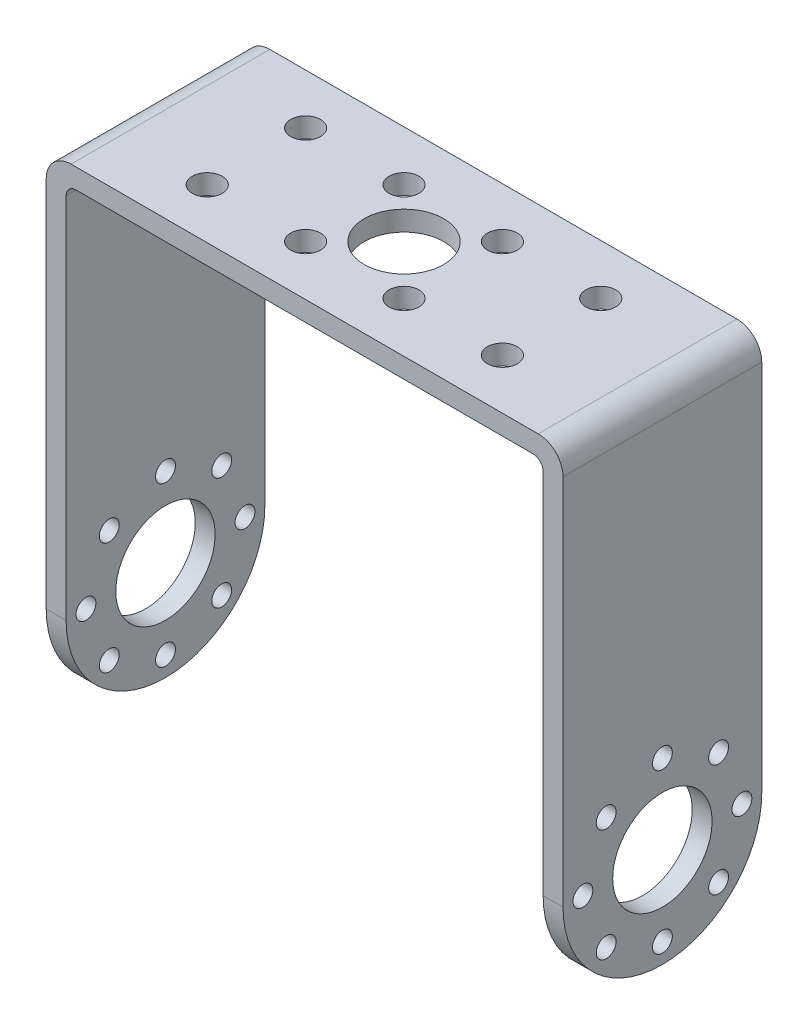
from build123d import *

# Parameters (mm, degrees)
EXTRUDE_1_DEPTH     = 20
FILLET_1_R          = 10
CUT_EXTRUDE_1_REACH = 61.8
SKETCH_3_R          = 4
SKETCH_3_R_2        = 1.5
SKETCH_4_R          = 5
SKETCH_4_R_2        = 1
CUT_EXTRUDE_2_DEPTH = 62.065538563
FILLET_2_R          = 2.5
FILLET_3_R          = 1


with BuildPart() as part:
    # 草图1 → 凸台-拉伸1 (new body)
    with BuildSketch(Plane.XY):
        Polygon((-24, 23), (24, 23), (24, -25), (26, -25), (26, 25), (-26, 25), (-26, -25), (-24, -25), align=None)
    extrude(amount=EXTRUDE_1_DEPTH)

    # 圆角1
    fillet_1_edges = [part.edges().sort_by_distance(p)[0] for p in [
        (-25, -25, 20),
        (-25, -25, 0),
        (25, -25, 0),
        (25, -25, 20),
    ]]
    fillet(fillet_1_edges, radius=FILLET_1_R - 0.0001)  # a hair under: the kernel refuses the full size

    # 草图3 → 切除-拉伸1 (cut, up to next)
    with BuildSketch(Plane(origin=(0, 25, 0), x_dir=(1, 0, 0), z_dir=(0, 1, 0)), mode=Mode.PRIVATE) as cut_extrude_1_sk1:
        with Locations(Location((0, -10, 0), (0, 0, 270))):
            Circle(SKETCH_3_R)
    cut_extrude_1_tool1 = extrude(cut_extrude_1_sk1.sketch, amount=-CUT_EXTRUDE_1_REACH, mode=Mode.PRIVATE) & part.part
    # 草图3 → 切除-拉伸1 (cut, up to next)
    with BuildSketch(Plane(origin=(0, 25, 0), x_dir=(1, 0, 0), z_dir=(0, 1, 0)), mode=Mode.PRIVATE) as cut_extrude_1_sk2:
        with Locations(Location((-4.949747468, -14.949747468, 0), (0, 0, 270))):
            Circle(SKETCH_3_R_2)
    cut_extrude_1_tool2 = extrude(cut_extrude_1_sk2.sketch, amount=-CUT_EXTRUDE_1_REACH, mode=Mode.PRIVATE) & part.part
    # 草图3 → 切除-拉伸1 (cut, up to next)
    with BuildSketch(Plane(origin=(0, 25, 0), x_dir=(1, 0, 0), z_dir=(0, 1, 0)), mode=Mode.PRIVATE) as cut_extrude_1_sk3:
        with Locations(Location((-4.949747468, -5.050252532, 0), (0, 0, 270))):
            Circle(SKETCH_3_R_2)
    cut_extrude_1_tool3 = extrude(cut_extrude_1_sk3.sketch, amount=-CUT_EXTRUDE_1_REACH, mode=Mode.PRIVATE) & part.part
    # 草图3 → 切除-拉伸1 (cut, up to next)
    with BuildSketch(Plane(origin=(0, 25, 0), x_dir=(1, 0, 0), z_dir=(0, 1, 0)), mode=Mode.PRIVATE) as cut_extrude_1_sk4:
        with Locations(Location((4.949747468, -5.050252532, 0), (0, 0, 270))):
            Circle(SKETCH_3_R_2)
    cut_extrude_1_tool4 = extrude(cut_extrude_1_sk4.sketch, amount=-CUT_EXTRUDE_1_REACH, mode=Mode.PRIVATE) & part.part
    # 草图3 → 切除-拉伸1 (cut, up to next)
    with BuildSketch(Plane(origin=(0, 25, 0), x_dir=(1, 0, 0), z_dir=(0, 1, 0)), mode=Mode.PRIVATE) as cut_extrude_1_sk5:
        with Locations(Location((4.949747468, -14.949747468, 0), (0, 0, 270))):
            Circle(SKETCH_3_R_2)
    cut_extrude_1_tool5 = extrude(cut_extrude_1_sk5.sketch, amount=-CUT_EXTRUDE_1_REACH, mode=Mode.PRIVATE) & part.part
    # 草图3 → 切除-拉伸1 (cut, up to next)
    with BuildSketch(Plane(origin=(0, 25, 0), x_dir=(1, 0, 0), z_dir=(0, 1, 0)), mode=Mode.PRIVATE) as cut_extrude_1_sk6:
        with Locations(Location((-14.849242405, -14.949747468, 0), (0, 0, 270))):
            Circle(SKETCH_3_R_2)
    cut_extrude_1_tool6 = extrude(cut_extrude_1_sk6.sketch, amount=-CUT_EXTRUDE_1_REACH, mode=Mode.PRIVATE) & part.part
    # 草图3 → 切除-拉伸1 (cut, up to next)
    with BuildSketch(Plane(origin=(0, 25, 0), x_dir=(1, 0, 0), z_dir=(0, 1, 0)), mode=Mode.PRIVATE) as cut_extrude_1_sk7:
        with Locations(Location((-14.849242405, -5.050252532, 0), (0, 0, 270))):
            Circle(SKETCH_3_R_2)
    cut_extrude_1_tool7 = extrude(cut_extrude_1_sk7.sketch, amount=-CUT_EXTRUDE_1_REACH, mode=Mode.PRIVATE) & part.part
    # 草图3 → 切除-拉伸1 (cut, up to next)
    with BuildSketch(Plane(origin=(0, 25, 0), x_dir=(1, 0, 0), z_dir=(0, 1, 0)), mode=Mode.PRIVATE) as cut_extrude_1_sk8:
        with Locations(Location((14.849242405, -5.050252532, 0), (0, 0, 270))):
            Circle(SKETCH_3_R_2)
    cut_extrude_1_tool8 = extrude(cut_extrude_1_sk8.sketch, amount=-CUT_EXTRUDE_1_REACH, mode=Mode.PRIVATE) & part.part
    # 草图3 → 切除-拉伸1 (cut, up to next)
    with BuildSketch(Plane(origin=(0, 25, 0), x_dir=(1, 0, 0), z_dir=(0, 1, 0)), mode=Mode.PRIVATE) as cut_extrude_1_sk9:
        with Locations(Location((14.849242405, -14.949747468, 0), (0, 0, 270))):
            Circle(SKETCH_3_R_2)
    cut_extrude_1_tool9 = extrude(cut_extrude_1_sk9.sketch, amount=-CUT_EXTRUDE_1_REACH, mode=Mode.PRIVATE) & part.part
    add(cut_extrude_1_tool1.solids().sort_by_distance((0, 25, 10))[0], mode=Mode.SUBTRACT)
    add(cut_extrude_1_tool2.solids().sort_by_distance((-4.949747, 25, 14.949747))[0], mode=Mode.SUBTRACT)
    add(cut_extrude_1_tool3.solids().sort_by_distance((-4.949747, 25, 5.050253))[0], mode=Mode.SUBTRACT)
    add(cut_extrude_1_tool4.solids().sort_by_distance((4.949747, 25, 5.050253))[0], mode=Mode.SUBTRACT)
    add(cut_extrude_1_tool5.solids().sort_by_distance((4.949747, 25, 14.949747))[0], mode=Mode.SUBTRACT)
    add(cut_extrude_1_tool6.solids().sort_by_distance((-14.849242, 25, 14.949747))[0], mode=Mode.SUBTRACT)
    add(cut_extrude_1_tool7.solids().sort_by_distance((-14.849242, 25, 5.050253))[0], mode=Mode.SUBTRACT)
    add(cut_extrude_1_tool8.solids().sort_by_distance((14.849242, 25, 5.050253))[0], mode=Mode.SUBTRACT)
    add(cut_extrude_1_tool9.solids().sort_by_distance((14.849242, 25, 14.949747))[0], mode=Mode.SUBTRACT)

    # 草图4 → 切除-拉伸2 (cut, through all)
    with BuildSketch(Plane.ZY.offset(26)):
        with Locations((10, -15)):
            Circle(SKETCH_4_R)
        with Locations((10, -7)):
            Circle(SKETCH_4_R_2)
        with Locations((15.656854249, -9.343145751)):
            Circle(SKETCH_4_R_2)
        with Locations((18, -15)):
            Circle(SKETCH_4_R_2)
        with Locations((15.656854249, -20.656854249)):
            Circle(SKETCH_4_R_2)
        with Locations((10, -23)):
            Circle(SKETCH_4_R_2)
        with Locations((4.343145751, -20.656854249)):
            Circle(SKETCH_4_R_2)
        with Locations((2, -15)):
            Circle(SKETCH_4_R_2)
        with Locations((4.343145751, -9.343145751)):
            Circle(SKETCH_4_R_2)
    extrude(amount=-CUT_EXTRUDE_2_DEPTH, mode=Mode.SUBTRACT)

    # 圆角2
    fillet_2_edges = [part.edges().sort_by_distance(p)[0] for p in [
        (-26, 25, 10),
        (26, 25, 10),
    ]]
    fillet(fillet_2_edges, radius=FILLET_2_R)

    # 圆角3
    fillet_3_edges = [part.edges().sort_by_distance(p)[0] for p in [
        (24, 23, 10),
        (-24, 23, 10),
    ]]
    fillet(fillet_3_edges, radius=FILLET_3_R)


solid = part.part
